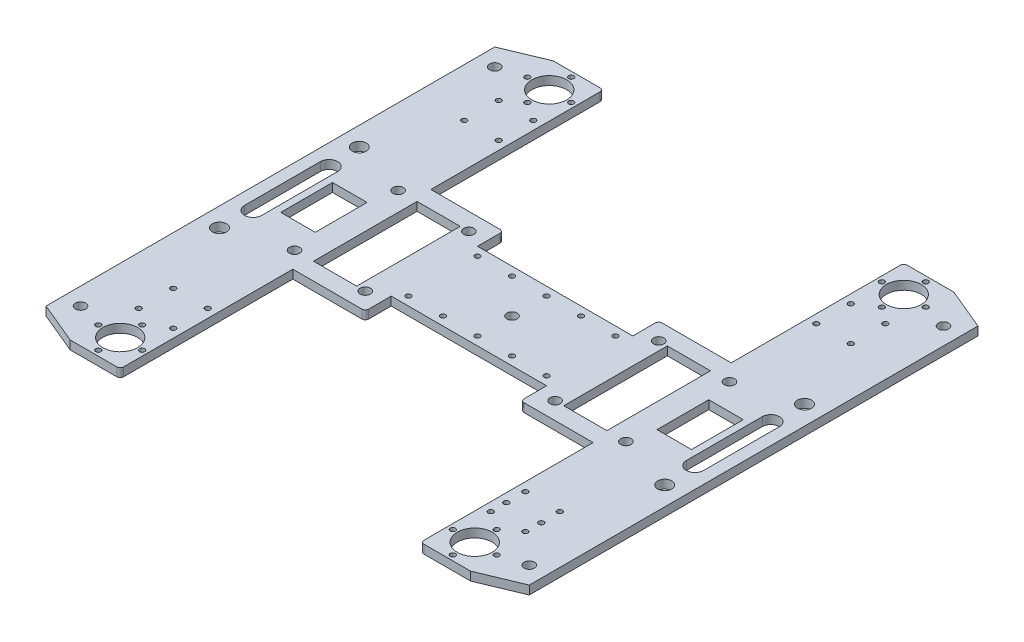
from build123d import *

# Parameters (mm, degrees)
ESQUISSE2_R                   = 3
ESQUISSE2_R_2                 = 10.1
ESQUISSE2_R_3                 = 1.5
ESQUISSE2_R_4                 = 4.1
ESQUISSE2_W                   = 25
ESQUISSE2_H                   = 60
ESQUISSE2_W_2                 = 20
ESQUISSE2_H_2                 = 30
BOSS_EXTRU_1_DEPTH            = 5
CONG_2_R                      = 2
DIAM_TRE_DU_PER_AGE_3_0_3_1_D = 3
ESQUISSE6_R                   = 1.495854397
ESQUISSE6_R_2                 = 1.51008819
ENL_V_MAT_EXTRU_1_DEPTH       = 10


with BuildPart() as part:
    # Esquisse2 → Boss.-Extru.1 (new body)
    with BuildSketch(Plane(origin=(0, 0, 0), x_dir=(1, 0, 0), z_dir=(0, 1, 0))):
        Polygon((-140, 130), (-140, -130), (-116, -140), (-87, -140), (-87, -40), (-45, -40), (-45, -25), (45, -25), (45, -40), (87, -40), (87, -140), (116, -140), (140, -130), (140, 130), (116, 140), (87, 140), (87, 40), (45, 40), (45, 25), (-45, 25), (-45, 40), (-87, 40), (-87, 140), (-116, 140), align=None)
        with Locations((-96, 30)):
            Circle(ESQUISSE2_R, mode=Mode.SUBTRACT)
        with Locations((-96, -30)):
            Circle(ESQUISSE2_R, mode=Mode.SUBTRACT)
        with Locations((-55, -30)):
            Circle(ESQUISSE2_R, mode=Mode.SUBTRACT)
        with Locations((-55, 30)):
            Circle(ESQUISSE2_R, mode=Mode.SUBTRACT)
        with Locations((-130, 120)):
            Circle(ESQUISSE2_R, mode=Mode.SUBTRACT)
        with Locations((-130, -120)):
            Circle(ESQUISSE2_R, mode=Mode.SUBTRACT)
        with Locations((-102.7, 124.3)):
            Circle(ESQUISSE2_R_2, mode=Mode.SUBTRACT)
        with Locations((-90, 124.3)):
            Circle(ESQUISSE2_R_3, mode=Mode.SUBTRACT)
        with Locations((-102.7, 137)):
            Circle(ESQUISSE2_R_3, mode=Mode.SUBTRACT)
        with Locations((-115.4, 124.3)):
            Circle(ESQUISSE2_R_3, mode=Mode.SUBTRACT)
        with Locations((-102.7, 111.6)):
            Circle(ESQUISSE2_R_3, mode=Mode.SUBTRACT)
        with Locations((-102.7, -124.3)):
            Circle(ESQUISSE2_R_2, mode=Mode.SUBTRACT)
        with Locations((-90, -124.3)):
            Circle(ESQUISSE2_R_3, mode=Mode.SUBTRACT)
        with Locations((-102.7, -111.6)):
            Circle(ESQUISSE2_R_3, mode=Mode.SUBTRACT)
        with Locations((-115.4, -124.3)):
            Circle(ESQUISSE2_R_3, mode=Mode.SUBTRACT)
        with Locations((-102.7, -137)):
            Circle(ESQUISSE2_R_3, mode=Mode.SUBTRACT)
        with Locations((102.7, -137)):
            Circle(ESQUISSE2_R_3, mode=Mode.SUBTRACT)
        with Locations((115.4, -124.3)):
            Circle(ESQUISSE2_R_3, mode=Mode.SUBTRACT)
        with Locations((102.7, -111.6)):
            Circle(ESQUISSE2_R_3, mode=Mode.SUBTRACT)
        with Locations((90, -124.3)):
            Circle(ESQUISSE2_R_3, mode=Mode.SUBTRACT)
        with Locations((102.7, -124.3)):
            Circle(ESQUISSE2_R_2, mode=Mode.SUBTRACT)
        with Locations((102.7, 111.6)):
            Circle(ESQUISSE2_R_3, mode=Mode.SUBTRACT)
        with Locations((115.4, 124.3)):
            Circle(ESQUISSE2_R_3, mode=Mode.SUBTRACT)
        with Locations((102.7, 137)):
            Circle(ESQUISSE2_R_3, mode=Mode.SUBTRACT)
        with Locations((90, 124.3)):
            Circle(ESQUISSE2_R_3, mode=Mode.SUBTRACT)
        with Locations((102.7, 124.3)):
            Circle(ESQUISSE2_R_2, mode=Mode.SUBTRACT)
        with Locations((130, -120)):
            Circle(ESQUISSE2_R, mode=Mode.SUBTRACT)
        with Locations((130, 120)):
            Circle(ESQUISSE2_R, mode=Mode.SUBTRACT)
        with Locations((55, 30)):
            Circle(ESQUISSE2_R, mode=Mode.SUBTRACT)
        with Locations((55, -30)):
            Circle(ESQUISSE2_R, mode=Mode.SUBTRACT)
        with Locations((96, -30)):
            Circle(ESQUISSE2_R, mode=Mode.SUBTRACT)
        with Locations((96, 30)):
            Circle(ESQUISSE2_R, mode=Mode.SUBTRACT)
        with Locations((-129, 40.5)):
            Circle(ESQUISSE2_R_4, mode=Mode.SUBTRACT)
        with Locations((-129, -40.5)):
            Circle(ESQUISSE2_R_4, mode=Mode.SUBTRACT)
        with Locations((129, -40.5)):
            Circle(ESQUISSE2_R_4, mode=Mode.SUBTRACT)
        with Locations((129, 40.5)):
            Circle(ESQUISSE2_R_4, mode=Mode.SUBTRACT)
        Circle(ESQUISSE2_R, mode=Mode.SUBTRACT)
        with Locations((-72.5, 0)):
            Rectangle(ESQUISSE2_W, ESQUISSE2_H, mode=Mode.SUBTRACT)
        with BuildLine():
            Line((-123, 22), (-123, -22))
            ThreePointArc((-123, -22), (-128, -27), (-133, -22))
            Line((-133, -22), (-133, 22))
            ThreePointArc((-133, 22), (-128, 27), (-123, 22))
        make_face(mode=Mode.SUBTRACT)
        with Locations((-109, 0)):
            Rectangle(ESQUISSE2_W_2, ESQUISSE2_H_2, mode=Mode.SUBTRACT)
        with Locations((109, 0)):
            Rectangle(ESQUISSE2_W_2, ESQUISSE2_H_2, mode=Mode.SUBTRACT)
        with Locations((72.5, 0)):
            Rectangle(ESQUISSE2_W, ESQUISSE2_H, mode=Mode.SUBTRACT)
        with BuildLine():
            Line((123, 22), (123, -22))
            ThreePointArc((123, -22), (128, -27), (133, -22))
            Line((133, -22), (133, 22))
            ThreePointArc((133, 22), (128, 27), (123, 22))
        make_face(mode=Mode.SUBTRACT)
    extrude(amount=BOSS_EXTRU_1_DEPTH)

    # Congé2
    cong_2_edges = [part.edges().sort_by_distance(p)[0] for p in [
        (-45, 2.5, -40),
        (45, 2.5, -40),
        (45, 2.5, 40),
        (-45, 2.5, 40),
        (87, 2.5, 140),
        (-87, 2.5, 140),
        (87, 2.5, -140),
        (-87, 2.5, -140),
    ]]
    fillet(cong_2_edges, radius=CONG_2_R)

    # Diamètre du perçage Ø3.0 (3)1 (through all)
    with Locations(Plane(origin=(0, 5, 0), x_dir=(1, 0, 0), z_dir=(0, 1, 0))):
        with Locations((-92, 104.3), (-92, 84.3), (-20, 20), (0, 20), (20, 20), (20, -20), (0, -20), (-20, -20), (-92, -104.3), (-92, -84.3), (92, -104.3), (92, -84.3), (92, 104.3), (92, 84.3), (112, 104.3), (112, 84.3), (-112, 104.3), (-112, 84.3), (-112, -84.3), (-112, -104.3), (112, -104.3), (112, -84.3), (40, -20), (40, 20), (-40, 20), (-40, -20)):
            Hole(DIAM_TRE_DU_PER_AGE_3_0_3_1_D / 2)

    # Esquisse6 → Enlèv. mat.-Extru.1 (cut)
    with BuildSketch(Plane.XZ):
        with Locations((112.218706977, 95.273590322)):
            Circle(ESQUISSE6_R)
        with Locations((91.995720379, 95.273590322)):
            Circle(ESQUISSE6_R_2)
    extrude(amount=-ENL_V_MAT_EXTRU_1_DEPTH, mode=Mode.SUBTRACT)


solid = part.part
